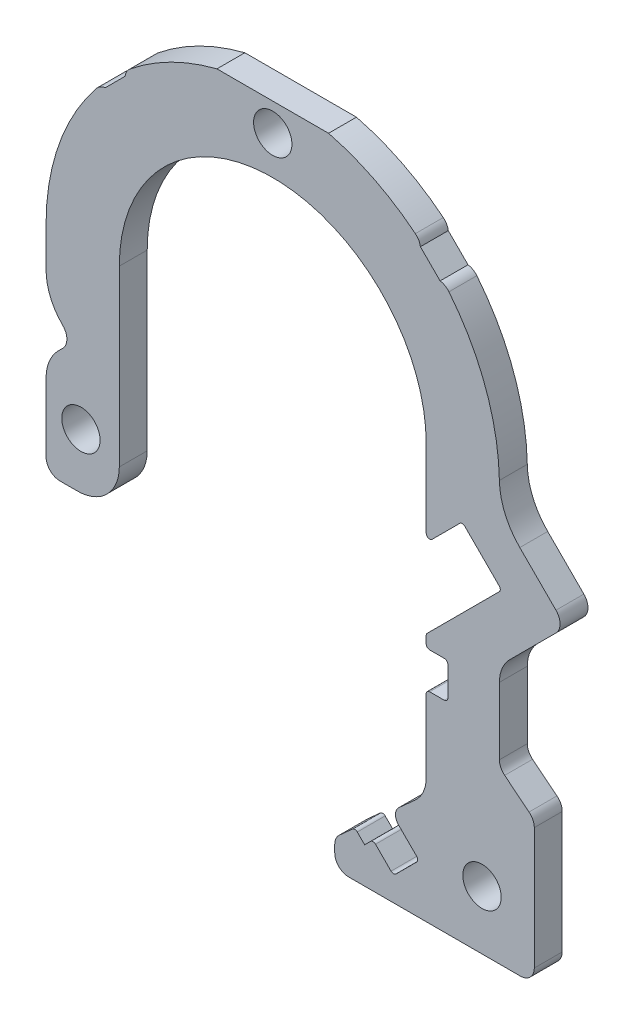
from build123d import *

# Parameters (mm, degrees)
CORPS_DEPTH                     = 4
DIAM_TRE_DU_PER_AGE_5_5_5_5_2_D = 5.5
RENFORT_CAVITE_IR_DEPTH         = 4
CAVITE_IR_DEPTH                 = 73.870494144
CAVITE_SWITCH_DEPTH             = 73.870494144
CONG_1_R                        = 2
CONG_1_R_2                      = 5
CONG_1_R_3                      = 10
CONG_1_R_4                      = 8
CONG_1_R_5                      = 6
CONG_1_R_6                      = 1.5
CONG_2_R                        = 0.5


with BuildPart() as part:
    # Esquisse1 → corps (new body)
    with BuildSketch(Plane.XY):
        with BuildLine():
            Line((-21.1677086, 23.996135725), (-21.1677086, 24.661267457))
            ThreePointArc((-21.1677086, 24.661267457), (-14.979348182, 28.84214153), (-8, 31.5))
            Line((-8, 31.5), (8, 31.5))
            ThreePointArc((8, 31.5), (14.979348182, 28.84214153), (21.1677086, 24.661267457))
            Line((21.1677086, 24.661267457), (21.1677086, 23.996135725))
            Line((21.1677086, 23.996135725), (23.996135725, 21.1677086))
            Line((23.996135725, 21.1677086), (24.661267457, 21.1677086))
            ThreePointArc((24.661267457, 21.1677086), (30.477378434, 11.286248439), (32.5, 0))
            Line((32.5, 0), (32.5, -35))
            Line((32.5, -35), (37.5, -39))
            Line((37.5, -39), (37.5, -59.4))
            Line((37.5, -59.4), (8.886620253, -59.4))
            Line((8.886620253, -59.4), (8.886620253, -56.358407696))
            ThreePointArc((8.886620253, -56.358407696), (9.059529338, -55.54493441), (9.54835904, -54.872118045))
            Line((9.54835904, -54.872118045), (20.413163329, -45.089404323))
            ThreePointArc((20.413163329, -45.089404323), (21.585367396, -43.476003838), (22, -41.525310806))
            Line((22, -41.525310806), (22, 0))
            ThreePointArc((22, 0), (0, 22), (-22, 0))
            Line((-22, 0), (-22, -24.928632557))
            ThreePointArc((-22, -24.928632557), (-23.757359313, -29.171273244), (-28, -30.928632557))
            Line((-28, -30.928632557), (-32.5, -30.928632557))
            Line((-32.5, -30.928632557), (-32.5, 0))
            ThreePointArc((-32.5, 0), (-30.477378434, 11.286248439), (-24.661267457, 21.1677086))
            Line((-24.661267457, 21.1677086), (-23.996135725, 21.1677086))
            Line((-23.996135725, 21.1677086), (-21.1677086, 23.996135725))
        make_face()
    extrude(amount=CORPS_DEPTH)

    # Diamètre du perçage Ø5.5 (5.5)2 (through all)
    with Locations(Plane.XY.offset(4)):
        with Locations((0, 27.5), (30, -51), (-27.5, -23)):
            Hole(DIAM_TRE_DU_PER_AGE_5_5_5_5_2_D / 2)

    # Esquisse4 → renfort_cavite_IR (add, through all)
    with BuildSketch(Plane.XY):
        Polygon((31.767766953, -2.575378798), (42.02081528, -12.828427125), (34.87903679, -19.970205615), (27.454415588, -27.394826817), (24.625988463, -9.717157288), align=None)
    extrude(amount=RENFORT_CAVITE_IR_DEPTH)

    # Esquisse4<4> → cavite_IR (cut, through all)
    with BuildSketch(Plane.XY):
        Polygon((0, -34.343145751), (24.625988463, -9.717157288), (27.171572875, -7.171572875), (32.828427125, -12.828427125), (30.282842712, -15.374011537), (0, -45.656854249), align=None)
        Polygon((-75.939696962, -31.797561338), (-42.828427125, 1.313708499), (-28.686291501, -12.828427125), (-61.797561338, -45.939696962), align=None)
    extrude(amount=CAVITE_IR_DEPTH, mode=Mode.SUBTRACT)

    # Esquisse5 → cavite_switch (cut, through all)
    with BuildSketch(Plane.XY):
        Polygon((13.884745674, -52.561700936), (12.661450942, -51.338406204), (16.338406204, -47.661450942), (17.561700936, -48.884745674), (17.915254326, -49.238299064), (20.920458146, -52.243502884), (20.991168825, -52.314213562), (17.314213562, -55.991168825), (17.243502884, -55.920458146), (14.238299064, -52.915254326), align=None)
        Polygon((13.884745674, -52.561700936), (12.661450942, -51.338406204), (11.459369414, -52.540487732), (13.177638892, -54.258757211), (14.37972042, -53.056675683), (14.238299064, -52.915254326), align=None)
        Polygon((18.52, -25.4), (20.25, -25.4), (20.75, -25.4), (25, -25.4), (25.1, -25.4), (25.1, -30.6), (25, -30.6), (20.75, -30.6), (20.25, -30.6), (18.52, -30.6), align=None)
        Polygon((20.75, -30.6), (20.25, -30.6), (18.52, -30.6), (18.52, -32.3), (20.95, -32.3), (20.95, -30.6), align=None)
    extrude(amount=CAVITE_SWITCH_DEPTH, mode=Mode.SUBTRACT)

    # Congé1
    # the kernel refuses this fillet: 10, 8, 6, 5, 2, 1.5 mm, written as the material it adds along each edge
    with BuildSketch(Plane(origin=(-28.686291501, -12.828427125, 0), x_dir=(-0.7071067811865516, 0.7071067811865436, 0), z_dir=(0, 0, 1))) as cong_1_piece_1:
        with BuildLine():
            CenterArc((CONG_1_R, CONG_1_R), CONG_1_R, 180, 90)
            Line((0, CONG_1_R), (0, 0))
            Line((0, 0), (CONG_1_R, 0))
        make_face()
    extrude(amount=4)
    with BuildSketch(Plane(origin=(32.5, -35, 0), x_dir=(0.7808688094430325, -0.6246950475544215, 0), z_dir=(0, 0, 1))) as cong_1_piece_2:
        with BuildLine():
            CenterArc((CONG_1_R * 0.480624847487, CONG_1_R), CONG_1_R, 218.659808254, 51.340191746)
            Line((-CONG_1_R * 0.300243961956, CONG_1_R * 0.375304952446), (0, 0))
            Line((0, 0), (CONG_1_R * 0.480624847487, 0))
        make_face()
    extrude(amount=4)
    with BuildSketch(Plane(origin=(32.5, -22.349242405, 4), x_dir=(0, -1, 0), z_dir=(0, 0, -1))) as cong_1_piece_3:
        with BuildLine():
            CenterArc((CONG_1_R_2 * 0.414213562373, -CONG_1_R_2), CONG_1_R_2, 90, 45)
            Line((-CONG_1_R_2 * 0.292893218813, -CONG_1_R_2 * 0.292893218813), (0, 0))
            Line((0, 0), (CONG_1_R_2 * 0.414213562373, 0))
        make_face()
    extrude(amount=4)
    with BuildSketch(Plane(origin=(32.5, -3.307611845, 0), x_dir=(0.7071067811865513, -0.7071067811865438, 0), z_dir=(0, 0, 1))) as cong_1_piece_4:
        with BuildLine():
            CenterArc((4.130314106, 10), CONG_1_R_3, 226.136395215, 43.863604785)
            Line((-2.799125719, 2.790085736), (-3.492069702, 2.069094309))
            ThreePointArc((-3.492069702, 2.069094309), (-3.045941546, 1.631727984), (-0.707106781, -0.707106781))
            Line((-0.707106781, -0.707106781), (0, -1))
            Line((0, -1), (4.130314106, -1))
            Line((4.130314106, -1), (4.130314106, 0))
        make_face()
    extrude(amount=4)
    # the kernel refuses this fillet: 10, 8, 6, 5, 2, 1.5 mm, written as the material it takes off along each edge
    with BuildSketch(Plane(origin=(-32.5, -30.928632557, -5), x_dir=(0, 1, 0), z_dir=(0, 0, 1)), Plane(origin=(37.5, -59.4, -5), x_dir=(-1, 0, 0), z_dir=(0, 0, 1)), Plane(origin=(42.02081528, -12.828427125, -5), x_dir=(-0.7071067811865427, -0.7071067811865525, 0), z_dir=(0, 0, 1)), Plane(origin=(8.886620253, -59.4, -5), x_dir=(0, 1, 0), z_dir=(0, 0, 1))) as cong_1_2_piece_1:
        with BuildLine():
            CenterArc((CONG_1_R, -CONG_1_R), CONG_1_R, 90, 90)
            Line((0, -CONG_1_R), (0, 0))
            Line((0, 0), (CONG_1_R, 0))
        make_face()
    extrude(amount=14, mode=Mode.SUBTRACT)
    with BuildSketch(Plane(origin=(37.5, -39, -2.403124237), x_dir=(0, -1, 0), z_dir=(0, 0, 1))) as cong_1_2_piece_2:
        with BuildLine():
            CenterArc((CONG_1_R * 0.480624847487, -CONG_1_R), CONG_1_R, 90, 51.340191746)
            Line((-CONG_1_R * 0.300243961956, -CONG_1_R * 0.375304952446), (0, 0))
            Line((0, 0), (CONG_1_R * 0.480624847487, 0))
        make_face()
    extrude(amount=8.806248475, mode=Mode.SUBTRACT)
    with BuildSketch(Plane(origin=(21.1677086, 24.661267457, -2.345925687), x_dir=(0, -1, 0), z_dir=(0, 0, 1)), Plane(origin=(-24.661267457, 21.1677086, -2.345925687), x_dir=(1, 0, 0), z_dir=(0, 0, 1))) as cong_1_2_piece_3:
        with BuildLine():
            CenterArc((0.953759933, -1.97906386), CONG_1_R, 98.297562286, 42.71603868)
            ThreePointArc((-0.600830724, -0.720792074), (-0.30301692, -0.358227456), (0, 0))
            Line((0, 0), (0.665131732, 0))
        make_face()
    extrude(amount=8.691851375, mode=Mode.SUBTRACT)
    with BuildSketch(Plane(origin=(24.661267457, 21.1677086, -2.345925687), x_dir=(-1, 0, 0), z_dir=(0, 0, 1)), Plane(origin=(-21.1677086, 24.661267457, -2.345925687), x_dir=(0, -1, 0), z_dir=(0, 0, 1))) as cong_1_2_piece_4:
        with BuildLine():
            CenterArc((0.953759933, 1.97906386), CONG_1_R, 218.986399033, 42.71603868)
            ThreePointArc((-0.600830724, 0.720792074), (-0.30301692, 0.358227456), (0, 0))
            Line((0, 0), (0.665131732, 0))
        make_face()
    extrude(amount=8.691851375, mode=Mode.SUBTRACT)
    with BuildSketch(Plane(origin=(-32.5, -9.014718626, 12.284271247), x_dir=(0, 1, 0), z_dir=(0, 0, -1))) as cong_1_2_piece_5:
        with BuildLine():
            CenterArc((CONG_1_R_4 * 0.414213562373, CONG_1_R_4), CONG_1_R_4, 225, 45)
            Line((-CONG_1_R_4 * 0.292893218813, CONG_1_R_4 * 0.292893218813), (0, 0))
            Line((0, 0), (CONG_1_R_4 * 0.414213562373, 0))
        make_face()
    extrude(amount=20.568542495, mode=Mode.SUBTRACT)
    with BuildSketch(Plane(origin=(-32.5, -16.642135624, -6.213203436), x_dir=(0.7071067811865432, 0.7071067811865519, 0), z_dir=(0, 0, 1))) as cong_1_2_piece_6:
        with BuildLine():
            CenterArc((CONG_1_R_5 * 0.414213562373, -CONG_1_R_5), CONG_1_R_5, 90, 45)
            Line((-CONG_1_R_5 * 0.292893218813, -CONG_1_R_5 * 0.292893218813), (0, 0))
            Line((0, 0), (CONG_1_R_5 * 0.414213562373, 0))
        make_face()
    extrude(amount=16.426406871, mode=Mode.SUBTRACT)
    with BuildSketch(Plane(origin=(16.915589345, -48.238634083, 7.95167547), x_dir=(0.7431448254773909, 0.6691306063588618, 0), z_dir=(0, 0, -1))) as cong_1_2_piece_7:
        with BuildLine():
            CenterArc((CONG_1_R_6 * 1.05378012528, CONG_1_R_6), CONG_1_R_6, 177, 93)
            Line((CONG_1_R_6 * 0.0551505905264, CONG_1_R_6 * 1.05233595624), (0, 0))
            Line((0, 0), (CONG_1_R_6 * 1.05378012528, 0))
        make_face()
    extrude(amount=11.90335094, mode=Mode.SUBTRACT)

    # Congé2
    cong_2_edges = [part.edges().sort_by_distance(p)[0] for p in [
        (22, -12.343145751, 2),
        (27.171572875, -7.171572875, 2),
        (22, -23.656854249, 2),
        (32.828427125, -12.828427125, 2),
        (11.780853072, -52.86197139, 2),
        (20.991168825, -52.314213562, 2),
        (14.37972042, -53.056675683, 2),
        (17.314213562, -55.991168825, 2),
        (22, -25.4, 2),
        (25.1, -25.4, 2),
        (22, -30.6, 2),
        (25.1, -30.6, 2),
    ]]
    fillet(cong_2_edges, radius=CONG_2_R)


solid = part.part
